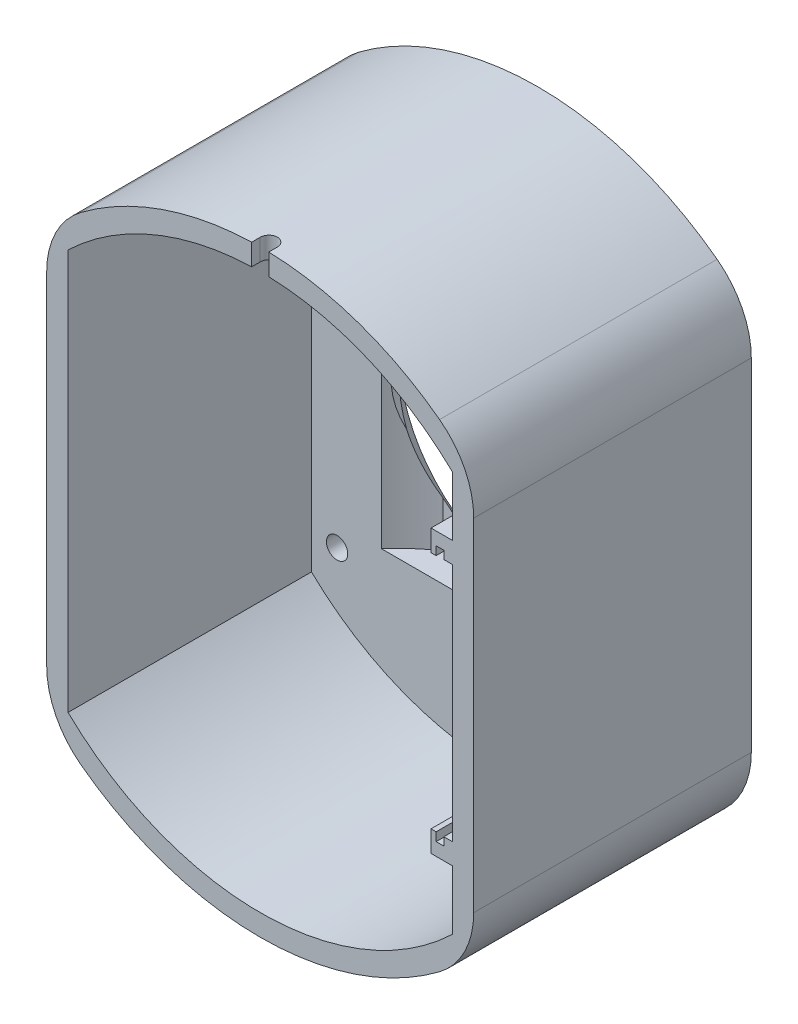
from build123d import *

# Parameters (mm, degrees)
EXTRUDE_2_DEPTH     = 65
SKETCH_1_3_R        = 2.5
BOSS_EXTRUDE1_DEPTH = 8
FILLET1_R           = 20
CHAMFER3_SIZE       = 5
BOSS_EXTRUDE3_DEPTH = 10
BOSS_EXTRUDE4_START = -45
BOSS_EXTRUDE4_DEPTH = 10
CUT_EXTRUDE2_DEPTH  = 108.819293264
SKETCH5_4_R         = 1.1
CUT_EXTRUDE3_DEPTH  = 68
CUT_EXTRUDE4_DEPTH  = 34
CHAMFER4_SIZE       = 2


with BuildPart() as part:
    # Эскиз1 → Extrude 2 (new body)
    with BuildSketch(Plane.XY):
        with BuildLine():
            ThreePointArc((-50, -48.989794856), (0, -70), (50, -48.989794856))
            Line((50, -48.989794856), (50, 48.989794856))
            ThreePointArc((50, 48.989794856), (0, 70), (-50, 48.989794856))
            Line((-50, 48.989794856), (-50, -48.989794856))
        make_face()
        with BuildLine():
            Line((45, -29.057462995), (45, -46.904157598))
            ThreePointArc((45, -46.904157598), (37.452737255, -53.125252678), (29.057462995, -58.143476369))
            ThreePointArc((29.057462995, -58.143476369), (0, -65), (-29.057462995, -58.143476369))
            ThreePointArc((-29.057462995, -58.143476369), (-37.452737255, -53.125252678), (-45, -46.904157598))
            Line((-45, -46.904157598), (-45, -29.057462995))
            Line((-45, -29.057462995), (-45, 29.057462995))
            Line((-45, 29.057462995), (-45, 46.904157598))
            ThreePointArc((-45, 46.904157598), (-37.452737255, 53.125252678), (-29.057462995, 58.143476369))
            ThreePointArc((-29.057462995, 58.143476369), (0, 65), (29.057462995, 58.143476369))
            ThreePointArc((29.057462995, 58.143476369), (37.452737255, 53.125252678), (45, 46.904157598))
            Line((45, 46.904157598), (45, 29.057462995))
            Line((45, 29.057462995), (45, -29.057462995))
        make_face(mode=Mode.SUBTRACT)
    extrude(amount=EXTRUDE_2_DEPTH)

    # Эскиз1<3> → Boss-Extrude1 (add)
    with BuildSketch(Plane.XY):
        with BuildLine():
            Line((45, -46.904157598), (45, 46.904157598))
            ThreePointArc((45, 46.904157598), (0, 65), (-45, 46.904157598))
            Line((-45, 46.904157598), (-45, -46.904157598))
            ThreePointArc((-45, -46.904157598), (0, -65), (45, -46.904157598))
        make_face()
        with Locations((39, -39)):
            Circle(SKETCH_1_3_R, mode=Mode.SUBTRACT)
        with BuildLine():
            Line((27.5, 0.1), (27.5, -0.1))
            ThreePointArc((27.5, -0.1), (19.474725805, -19.474725805), (0.1, -27.5))
            Line((0.1, -27.5), (-0.1, -27.5))
            ThreePointArc((-0.1, -27.5), (-19.474725805, -19.474725805), (-27.5, -0.1))
            Line((-27.5, -0.1), (-27.5, 0.1))
            ThreePointArc((-27.5, 0.1), (-19.474725805, 19.474725805), (-0.1, 27.5))
            Line((-0.1, 27.5), (0.1, 27.5))
            ThreePointArc((0.1, 27.5), (19.474725805, 19.474725805), (27.5, 0.1))
        make_face(mode=Mode.SUBTRACT)
        with Locations((-39, -39)):
            Circle(SKETCH_1_3_R, mode=Mode.SUBTRACT)
        with Locations((-39, 39)):
            Circle(SKETCH_1_3_R, mode=Mode.SUBTRACT)
        with Locations((39, 39)):
            Circle(SKETCH_1_3_R, mode=Mode.SUBTRACT)
    extrude(amount=BOSS_EXTRUDE1_DEPTH)

    # Fillet1
    fillet1_edges = [part.edges().sort_by_distance(p)[0] for p in [
        (50, -48.989794856, 32.5),
        (-50, -48.989794856, 32.5),
        (-50, 48.989794856, 32.5),
        (50, 48.989794856, 32.5),
    ]]
    fillet(fillet1_edges, radius=FILLET1_R)

    # Chamfer3
    chamfer3_edges = [part.edges().sort_by_distance(p)[0] for p in [
        (27.5, 0, 0),
        (19.474725805, 19.474725805, 0),
        (19.474725805, -19.474725805, 0),
        (0, 27.5, 0),
        (0, -27.5, 0),
        (-19.474725805, 19.474725805, 0),
        (-19.474725805, -19.474725805, 0),
        (-27.5, 0, 0),
    ]]
    chamfer(chamfer3_edges, length=CHAMFER3_SIZE)

    # Sketch3 → Boss-Extrude3 (add)
    with BuildSketch(Plane.XY.offset(65)):
        Polygon((41.2, -30), (41.2, -28), (40, -28), (40, -33), (45, -33), (45, -28.104490543), (43, -28.104490543), (43, -30), align=None)
        Polygon((45, 28.104490543), (45, 33), (40, 33), (40, 28), (41.2, 28), (41.2, 30), (43, 30), (43, 28.104490543), align=None)
    extrude(amount=-BOSS_EXTRUDE3_DEPTH)

    # Sketch3<2> → Boss-Extrude4 (add)
    with BuildSketch(Plane.XY.offset(65).offset(BOSS_EXTRUDE4_START)):
        Polygon((41.2, -30), (41.2, -28), (40, -28), (40, -33), (45, -33), (45, -28.104490543), (43, -28.104490543), (43, -30), align=None)
        Polygon((45, 28.104490543), (45, 33), (40, 33), (40, 28), (41.2, 28), (41.2, 30), (43, 30), (43, 28.104490543), align=None)
    extrude(amount=BOSS_EXTRUDE4_DEPTH)

    # Sketch5 → Cut-Extrude2 (cut, through all)
    with BuildSketch(Plane(origin=(0, 0, 0), x_dir=(1, 0, 0), z_dir=(0, 1, 0))):
        with BuildLine():
            ThreePointArc((2, -63), (0, -61), (-2, -63))
            Line((-2, -63), (-2, -65))
            Line((-2, -65), (2, -65))
            Line((2, -65), (2, -63))
        make_face()
    extrude(amount=CUT_EXTRUDE2_DEPTH, mode=Mode.SUBTRACT)

    # Sketch5<4> → Cut-Extrude3 (cut)
    with BuildSketch(Plane(origin=(0, 0, 0), x_dir=(1, 0, 0), z_dir=(0, 1, 0))):
        with Locations((5, -55)):
            Circle(SKETCH5_4_R)
        with Locations((-5, -55)):
            Circle(SKETCH5_4_R)
    extrude(amount=CUT_EXTRUDE3_DEPTH, mode=Mode.SUBTRACT)

    # Sketch6 → Cut-Extrude4 (cut, symmetric)
    with BuildSketch(Plane(origin=(0, 0, 0), x_dir=(1, 0, 0), z_dir=(0, 1, 0))):
        with BuildLine():
            Line((21, -1.25), (-21, -1.25))
            ThreePointArc((-21, -1.25), (-25.022986776, -4.367942969), (-28.588677829, -8))
            Line((-28.588677829, -8), (28.588677829, -8))
            ThreePointArc((28.588677829, -8), (25.022986776, -4.367942969), (21, -1.25))
        make_face()
    extrude(amount=CUT_EXTRUDE4_DEPTH, both=True, mode=Mode.SUBTRACT)

    # Chamfer4
    chamfer4_edges = [part.edges().sort_by_distance(p)[0] for p in [
        (36.5, 39, 0),
        (-41.5, 39, 0),
        (-41.5, -39, 0),
        (36.5, -39, 0),
    ]]
    chamfer(chamfer4_edges, length=CHAMFER4_SIZE)


solid = part.part
